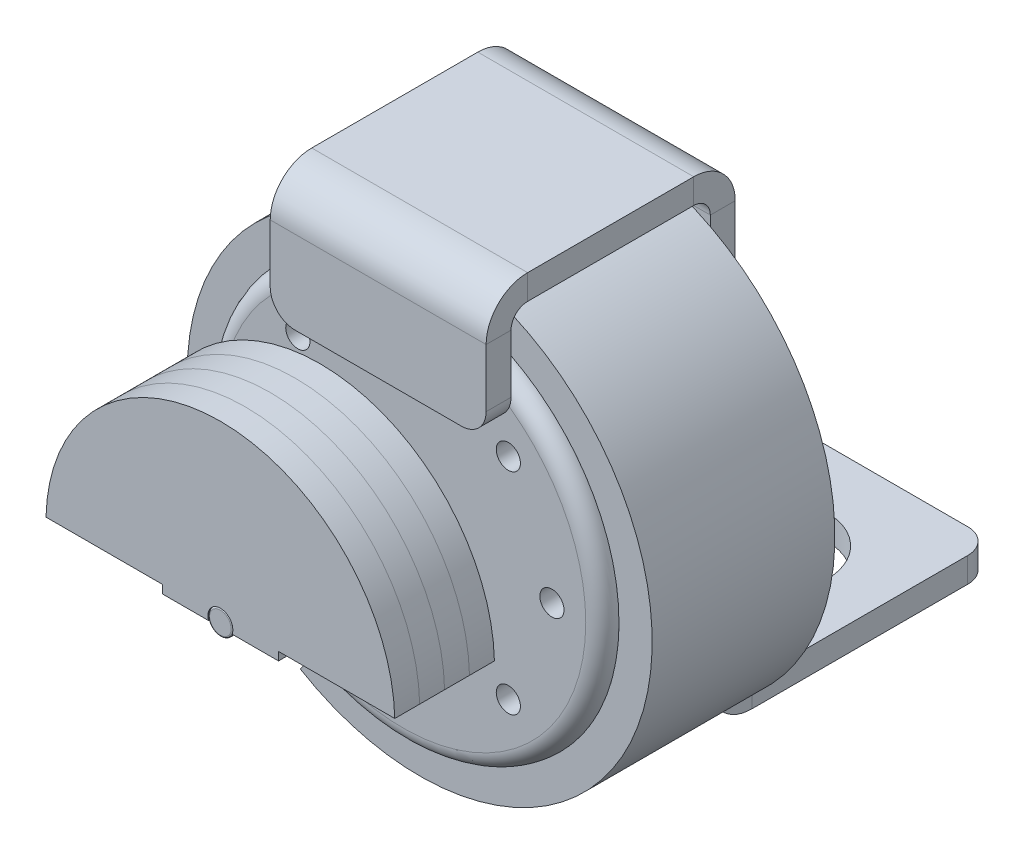
from build123d import *

# Parameters (mm, degrees)
ESQUISSE1_R                  = 12
BOSS_EXTRU_1_DEPTH           = 12
CONG_1_R                     = 1
ESQUISSE3_R                  = 14
ESQUISSE3_R_2                = 12
BOSS_EXTRU_2_DEPTH           = 11
T_LE_DE_BASE_PLI_E1_DEPTH    = 6.5
CONG_2_R                     = 1.5
ESQUISSE9_R                  = 3.5
ENL_V_MAT_EXTRU_1_DEPTH      = 1.5
ESQUISSE11_R                 = 3
BOSS_EXTRU_3_DEPTH           = 1
ESQUISSE14_R                 = 0.75
BOSS_EXTRU_4_DEPTH           = 10
CONG_3_R                     = 0.1
BOSS_EXTRU_5_DEPTH           = 1.5
R_P_TITION_LIN_AIRE1_COUNT   = 4
R_P_TITION_LIN_AIRE1_PITCH   = 1.5
ENL_V_START                  = -11
ENL_V_MAT_EXTRU_2_DEPTH      = 11
ESQUISSE17_R                 = 0.727985747
ENL_V_MAT_EXTRU_3_DEPTH      = 2
R_P_TITION_CIRCULAIRE1_COUNT = 8


# Sheet-metal steps are written as plain solids
with BuildPart() as part:
    # Esquisse1 → Boss.-Extru.1 (new body)
    with BuildSketch(Plane.XY):
        Circle(ESQUISSE1_R)
    extrude(amount=BOSS_EXTRU_1_DEPTH)

    # Congé1
    cong_1_edges = [part.edges().sort_by_distance(p)[0] for p in [
        (-12, 0, 12),
    ]]
    fillet(cong_1_edges, radius=CONG_1_R)



with BuildPart() as body_2:
    # Esquisse3 → Boss.-Extru.2 (new body)
    with BuildSketch(Plane(origin=(0, 0, 0), x_dir=(-1, 0, 0), z_dir=(0, 0, -1))):
        Circle(ESQUISSE3_R)
        Circle(ESQUISSE3_R_2, mode=Mode.SUBTRACT)
    extrude(amount=-BOSS_EXTRU_2_DEPTH)

    # Esquisse16 → Enlèv. mat.-Extru.2 (cut)
    with BuildSketch(Plane.XY.offset(11).offset(ENL_V_START)):
        with BuildLine():
            Line((-8.828711085, -10.865259342), (-7.678128626, -9.222057298))
            ThreePointArc((-7.678128626, -9.222057298), (-6.882917236, -9.829824531), (-6.039824538, -10.36921017))
            Line((-6.039824538, -10.36921017), (-7.190406996, -12.012412215))
            ThreePointArc((-7.190406996, -12.012412215), (-8.030070109, -11.46812862), (-8.828711085, -10.865259342))
        make_face()
    extrude(amount=ENL_V_MAT_EXTRU_2_DEPTH, mode=Mode.SUBTRACT)


with BuildPart() as body_3:
    # Esquisse4 → Tôle de base pliée1 (new, symmetric)
    with BuildSketch(Plane(origin=(0, 0, 0), x_dir=(0, 0, -1), z_dir=(1, 0, 0))):
        with BuildLine():
            Line((-12, 8), (-12, 13))
            ThreePointArc((-12, 13), (-11.707106781, 13.707106781), (-11, 14))
            Line((-11, 14), (-1, 14))
            ThreePointArc((-1, 14), (-0.292893219, 13.707106781), (0, 13))
            Line((0, 13), (0, -11.5))
            ThreePointArc((0, -11.5), (0.732233047, -13.267766953), (2.5, -14))
            Line((2.5, -14), (17, -14))
            Line((17, -14), (17, -12.5))
            Line((17, -12.5), (2.5, -12.5))
            ThreePointArc((2.5, -12.5), (1.792893219, -12.207106781), (1.5, -11.5))
            Line((1.5, -11.5), (1.5, 13))
            ThreePointArc((1.5, 13), (0.767766953, 14.767766953), (-1, 15.5))
            Line((-1, 15.5), (-11, 15.5))
            ThreePointArc((-11, 15.5), (-12.767766953, 14.767766953), (-13.5, 13))
            Line((-13.5, 13), (-13.5, 8))
            Line((-13.5, 8), (-12, 8))
        make_face()
    extrude(amount=T_LE_DE_BASE_PLI_E1_DEPTH, both=True)

    # Congé2
    cong_2_edges = [body_3.edges().sort_by_distance(p)[0] for p in [
        (-6.5, 8, 12.75),
        (-6.5, -13.25, -17),
        (6.5, 8, 12.75),
        (6.5, -13.25, -17),
    ]]
    fillet(cong_2_edges, radius=CONG_2_R)

    # Esquisse9 → Enlèv. mat.-Extru.1 (cut)
    with BuildSketch(Plane.XZ.offset(14)):
        with Locations(Location((0, -10, 0), (0, 0, 270))):
            Circle(ESQUISSE9_R)
    extrude(amount=-ENL_V_MAT_EXTRU_1_DEPTH, mode=Mode.SUBTRACT)


with BuildPart() as part_1:
    add(part.part)

    add(body_3.part)  # Boss.-Extru.3 merges body 3
    # Esquisse11 → Boss.-Extru.3 (add)
    with BuildSketch(Plane.XY.offset(12)):
        Circle(ESQUISSE11_R)
    extrude(amount=BOSS_EXTRU_3_DEPTH)

    # Esquisse14 → Boss.-Extru.4 (add)
    with BuildSketch(Plane.XY.offset(13)):
        Circle(ESQUISSE14_R)
    extrude(amount=BOSS_EXTRU_4_DEPTH)

    # Congé3
    cong_3_edges = [part_1.edges().sort_by_distance(p)[0] for p in [
        (-0.75, 0, 23),
    ]]
    fillet(cong_3_edges, radius=CONG_3_R)

    # Esquisse17 → Enlèv. mat.-Extru.3 (cut)
    with BuildSketch(Plane.XY.offset(12)):
        with Locations((0, -8.962862468)):
            Circle(ESQUISSE17_R)
    enl_v_mat_extru_3 = extrude(amount=-ENL_V_MAT_EXTRU_3_DEPTH, mode=Mode.SUBTRACT)

    # Répétition circulaire1: Enlèv. mat.-Extru.3 ×8 about axis
    r_p_tition_circulaire1_axis = Axis((0, 0, 0), (0, 0, 1))
    for i in range(1, R_P_TITION_CIRCULAIRE1_COUNT):
        add(enl_v_mat_extru_3.rotate(r_p_tition_circulaire1_axis, i * 360 / R_P_TITION_CIRCULAIRE1_COUNT), mode=Mode.SUBTRACT)


with BuildPart() as body_3_2:
    # Esquisse15 → Boss.-Extru.5 (new body)
    with BuildSketch(Plane.XY.offset(23)):
        with BuildLine():
            Line((-3.5, -0.25), (-0.707106781, -0.25))
            ThreePointArc((-0.707106781, -0.25), (0, 0.75), (0.707106781, -0.25))
            Line((0.707106781, -0.25), (3.5, -0.25))
            Line((3.5, -0.25), (3.5, 0.25))
            Line((3.5, 0.25), (10.5, 0.25))
            ThreePointArc((10.5, 0.25), (0, 10.502975769), (-10.5, 0.25))
            Line((-10.5, 0.25), (-3.5, 0.25))
            Line((-3.5, 0.25), (-3.5, -0.25))
        make_face()
    extrude(amount=-BOSS_EXTRU_5_DEPTH)


with BuildPart() as r_p_tition_lin_aire1_1:
    # Répétition linéaire1: pattern copy
    add(body_3_2.part.moved(Location(Vector(0, 0, -1) * (1 * R_P_TITION_LIN_AIRE1_PITCH))))


with BuildPart() as r_p_tition_lin_aire1_2:
    # Répétition linéaire1: pattern copy
    add(body_3_2.part.moved(Location(Vector(0, 0, -1) * (2 * R_P_TITION_LIN_AIRE1_PITCH))))


with BuildPart() as r_p_tition_lin_aire1_3:
    # Répétition linéaire1: pattern copy
    add(body_3_2.part.moved(Location(Vector(0, 0, -1) * (3 * R_P_TITION_LIN_AIRE1_PITCH))))


solid = Compound([body_2.part, part_1.part, body_3_2.part, r_p_tition_lin_aire1_1.part, r_p_tition_lin_aire1_2.part, r_p_tition_lin_aire1_3.part])
